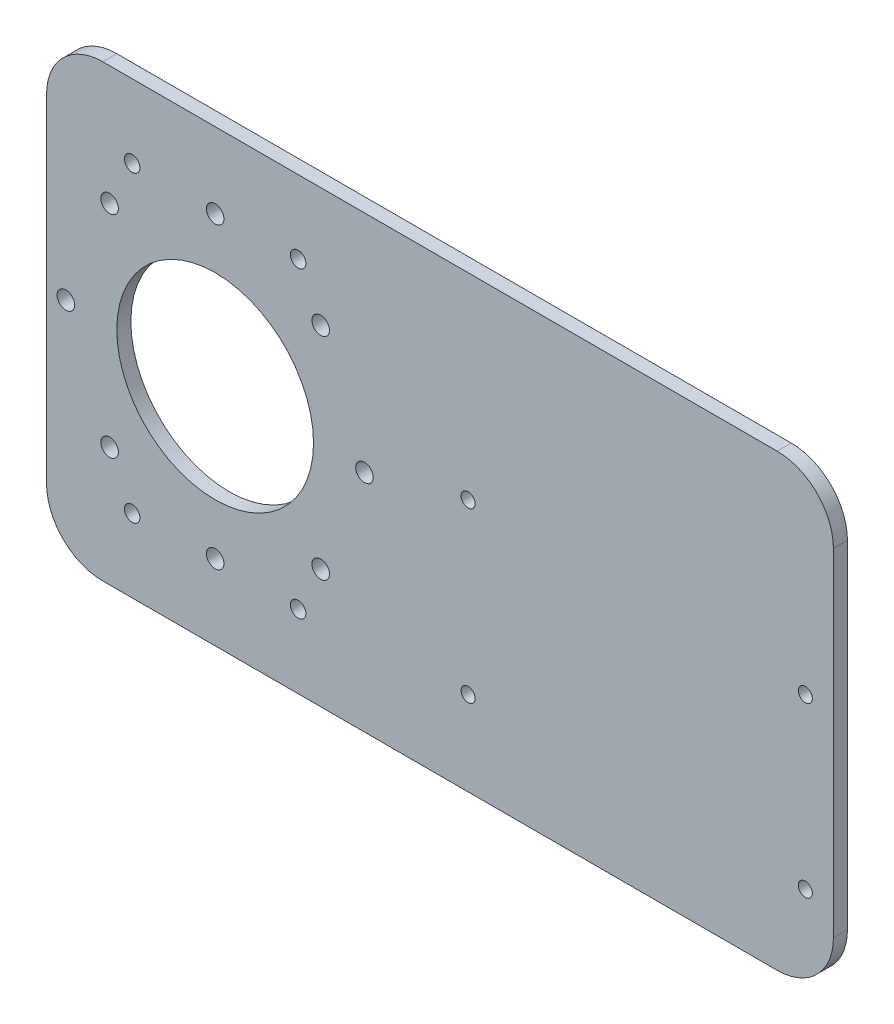
from build123d import *

# Parameters (mm, degrees)
SKETCH1_W           = 355.6
SKETCH1_H           = 203.2
BOSS_EXTRUDE1_DEPTH = 6.35
SKETCH2_R           = 44.45
SKETCH2_R_2         = 3.96875
CUT_EXTRUDE1_DEPTH  = 76.2
SKETCH3_R           = 3.50012
CUT_EXTRUDE2_DEPTH  = 6.35
FILLET1_R           = 25.4
SKETCH5_R           = 3.175
CUT_EXTRUDE4_DEPTH  = 6.35


with BuildPart() as part:
    # Sketch1 → Boss-Extrude1 (new body)
    with BuildSketch(Plane.XY):
        with Locations((177.8, 101.6)):
            Rectangle(SKETCH1_W, SKETCH1_H)
    extrude(amount=BOSS_EXTRUDE1_DEPTH)

    # Sketch2 → Cut-Extrude1 (cut)
    with BuildSketch(Plane.XY.offset(6.35)):
        with Locations((76.2, 101.6)):
            Circle(SKETCH2_R)
        with Locations((143.66875, 101.6)):
            Circle(SKETCH2_R_2)
        with Locations((123.907610643, 53.892389357)):
            Circle(SKETCH2_R_2)
        with Locations((76.2, 34.13125)):
            Circle(SKETCH2_R_2)
        with Locations((28.492389357, 53.892389357)):
            Circle(SKETCH2_R_2)
        with Locations((8.73125, 101.6)):
            Circle(SKETCH2_R_2)
        with Locations((28.492389357, 149.307610643)):
            Circle(SKETCH2_R_2)
        with Locations((76.2, 169.06875)):
            Circle(SKETCH2_R_2)
        with Locations((123.907610643, 149.307610643)):
            Circle(SKETCH2_R_2)
    extrude(amount=-CUT_EXTRUDE1_DEPTH, mode=Mode.SUBTRACT)

    # Sketch3 → Cut-Extrude2 (cut)
    with BuildSketch(Plane.XY.offset(6.35)):
        with Locations((38.69944, 170.09999)):
            Circle(SKETCH3_R)
        with Locations((113.70056, 170.09999)):
            Circle(SKETCH3_R)
        with Locations((113.70056, 33.10001)):
            Circle(SKETCH3_R)
        with Locations((38.69944, 33.10001)):
            Circle(SKETCH3_R)
    extrude(amount=-CUT_EXTRUDE2_DEPTH, mode=Mode.SUBTRACT)

    # Fillet1
    fillet1_edges = [part.edges().sort_by_distance(p)[0] for p in [
        (0, 203.2, 3.175),
        (0, 0, 3.175),
        (355.6, 0, 3.175),
        (355.6, 203.2, 3.175),
    ]]
    fillet(fillet1_edges, radius=FILLET1_R)

    # Sketch5 → Cut-Extrude4 (cut)
    with BuildSketch(Plane(origin=(0, 0, 0), x_dir=(-1, 0, 0), z_dir=(0, 0, -1))):
        with Locations((-342.9, 114.3)):
            Circle(SKETCH5_R)
        with Locations((-190.5, 114.3)):
            Circle(SKETCH5_R)
        with Locations((-190.5, 38.1)):
            Circle(SKETCH5_R)
        with Locations((-342.9, 38.1)):
            Circle(SKETCH5_R)
    extrude(amount=-CUT_EXTRUDE4_DEPTH, mode=Mode.SUBTRACT)


solid = part.part
